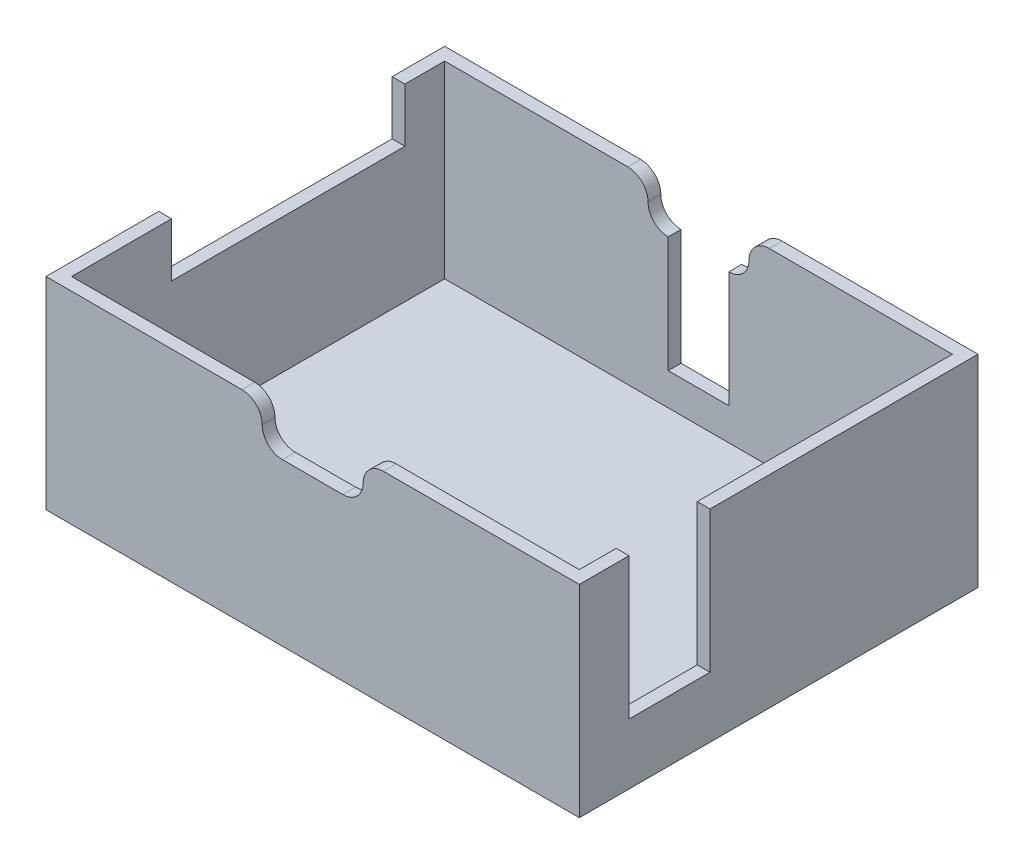
from build123d import *

# Parameters (mm, degrees)
SKETCH1_W           = 100.584
SKETCH1_H           = 75.184
BOSS_EXTRUDE1_DEPTH = 2.54
SKETCH2_W           = 100.584
SKETCH2_H           = 75.184
SKETCH2_W_2         = 95.758
SKETCH2_H_2         = 70.358
BOSS_EXTRUDE2_DEPTH = 35.56
SKETCH3_W           = 19.05
SKETCH3_H           = 7.62
CUT_EXTRUDE1_DEPTH  = 132.230274373
FILLET1_R           = 3.81
CUT_EXTRUDE2_DEPTH  = 6.35
SKETCH5_W           = 15.278664452
SKETCH5_H           = 26.67
CUT_EXTRUDE3_DEPTH  = 6.35
SKETCH6_W           = 11.43
SKETCH6_H           = 21.859082526
CUT_EXTRUDE4_DEPTH  = 6.35


with BuildPart() as part:
    # Sketch1 → Boss-Extrude1 (new body)
    with BuildSketch(Plane(origin=(0, 0, 0), x_dir=(1, 0, 0), z_dir=(0, 1, 0))):
        with Locations((50.292, 37.592)):
            Rectangle(SKETCH1_W, SKETCH1_H)
    extrude(amount=BOSS_EXTRUDE1_DEPTH)

    # Sketch2 → Boss-Extrude2 (add)
    with BuildSketch(Plane(origin=(0, 2.54, 0), x_dir=(1, 0, 0), z_dir=(0, 1, 0))):
        with Locations((50.292, 37.592)):
            Rectangle(SKETCH2_W, SKETCH2_H)
        with Locations((50.292, 37.592)):
            Rectangle(SKETCH2_W_2, SKETCH2_H_2, mode=Mode.SUBTRACT)
    extrude(amount=BOSS_EXTRUDE2_DEPTH)

    # Sketch3 → Cut-Extrude1 (cut, through all)
    with BuildSketch(Plane(origin=(0, 0, -75.184), x_dir=(-1, 0, 0), z_dir=(0, 0, -1))):
        with Locations((-50.292, 34.29)):
            Rectangle(SKETCH3_W, SKETCH3_H)
    extrude(amount=-CUT_EXTRUDE1_DEPTH, mode=Mode.SUBTRACT)

    # Fillet1
    fillet1_edges = [part.edges().sort_by_distance(p)[0] for p in [
        (40.767, 30.48, -1.2065),
        (59.817, 30.48, -1.2065),
        (59.817, 30.48, -73.9775),
        (40.767, 30.48, -73.9775),
    ]]
    fillet(fillet1_edges, radius=FILLET1_R)
    fillet1_2_edges = [part.edges().sort_by_distance(p)[0] for p in [
        (40.767, 38.1, -1.2065),
        (59.817, 38.1, -1.2065),
        (59.817, 38.1, -73.9775),
        (40.767, 38.1, -73.9775),
    ]]
    fillet(fillet1_2_edges, radius=FILLET1_R - 0.0001)  # a hair under: the kernel refuses the full size

    # Sketch4 → Cut-Extrude2 (cut)
    with BuildSketch(Plane.ZY):
        Polygon((-21.270705039, 38.1), (-58.928, 38.1), (-65.278, 38.1), (-65.278, 31.750254), (-65.278, 27.940254), (-58.928, 27.940254), (-21.270705039, 27.940254), align=None)
    extrude(amount=-CUT_EXTRUDE2_DEPTH, mode=Mode.SUBTRACT)

    # Sketch5 → Cut-Extrude3 (cut)
    with BuildSketch(Plane(origin=(100.584, 0, 0), x_dir=(0, 0, -1), z_dir=(1, 0, 0))):
        with Locations((16.998667774, 24.765254)):
            Rectangle(SKETCH5_W, SKETCH5_H)
    extrude(amount=-CUT_EXTRUDE3_DEPTH, mode=Mode.SUBTRACT)

    # Sketch6 → Cut-Extrude4 (cut)
    with BuildSketch(Plane(origin=(0, 0, -75.184), x_dir=(-1, 0, 0), z_dir=(0, 0, -1))):
        with Locations((-50.292, 19.550458737)):
            Rectangle(SKETCH6_W, SKETCH6_H)
    extrude(amount=-CUT_EXTRUDE4_DEPTH, mode=Mode.SUBTRACT)


solid = part.part
